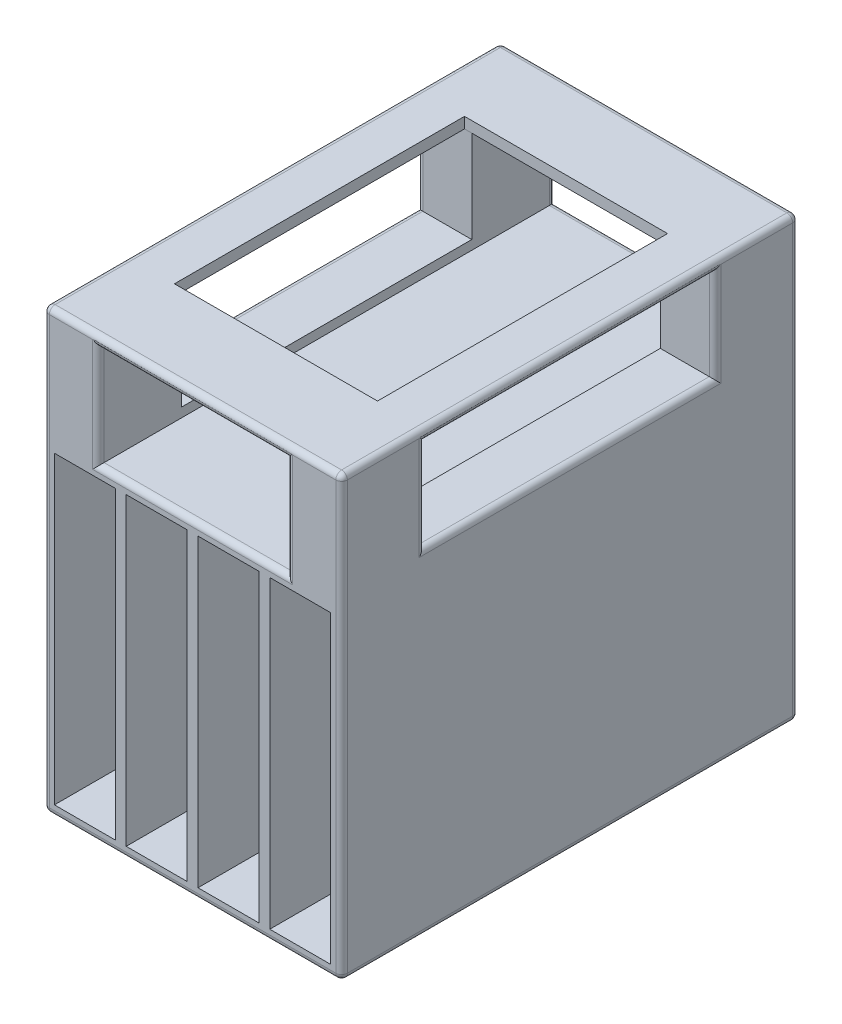
from build123d import *

# Parameters (mm, degrees)
SKETCH7_W           = 102.75
SKETCH7_H           = 151.25
BOSS_EXTRUDE4_DEPTH = 157.5
SKETCH9_W           = 65
SKETCH9_H           = 35
SKETCH9_W_2         = 21
SKETCH9_H_2         = 105
CUT_EXTRUDE5_DEPTH  = 157.5
SKETCH10_W          = 100
SKETCH10_H          = 31.776495021
CUT_EXTRUDE6_DEPTH  = 157.5
FILLET3_R           = 2
FILLET4_R           = 2
FILLET6_R           = 2
FILLET7_R           = 2
FILLET8_R           = 2
FILLET9_R           = 2
SKETCH13_W          = 70
SKETCH13_H          = 100
CUT_EXTRUDE7_DEPTH  = 3.75


with BuildPart() as part:
    # Sketch7 → Boss-Extrude4 (new body)
    with BuildSketch(Plane.XY):
        with Locations((-8.261523783, -58.812543528)):
            Rectangle(SKETCH7_W, SKETCH7_H)
    extrude(amount=BOSS_EXTRUDE4_DEPTH)

    # Sketch9 → Cut-Extrude5 (cut)
    with BuildSketch(Plane.XY.offset(157.5)):
        with Locations((-8.261523783, -4.437543528)):
            Rectangle(SKETCH9_W, SKETCH9_H)
        with Locations((-45.386523783, -78.187543528)):
            Rectangle(SKETCH9_W_2, SKETCH9_H_2)
        with Locations((-20.636523783, -78.187543528)):
            Rectangle(SKETCH9_W_2, SKETCH9_H_2)
        with Locations((4.113476217, -78.187543528)):
            Rectangle(SKETCH9_W_2, SKETCH9_H_2)
        with Locations((28.863476217, -78.187543528)):
            Rectangle(SKETCH9_W_2, SKETCH9_H_2)
    extrude(amount=-CUT_EXTRUDE5_DEPTH, mode=Mode.SUBTRACT)

    # Sketch10 → Cut-Extrude6 (cut)
    with BuildSketch(Plane.ZY.offset(59.636523783)):
        with Locations((78.75, -2.825791039)):
            Rectangle(SKETCH10_W, SKETCH10_H)
    extrude(amount=-CUT_EXTRUDE6_DEPTH, mode=Mode.SUBTRACT)

    # Fillet3
    fillet3_edges = [part.edges().sort_by_distance(p)[0] for p in [
        (43.113476217, 16.812456472, 78.75),
    ]]
    fillet(fillet3_edges, radius=FILLET3_R)

    # Fillet4
    fillet4_edges = [part.edges().sort_by_distance(p)[0] for p in [
        (-9.261523783, 16.812456472, 0),
        (-9.261523783, 16.812456472, 157.5),
        (42.52768978, 16.226670034, 0),
        (42.52768978, 16.226670034, 157.5),
        (43.113476217, -59.812543528, 157.5),
        (43.113476217, -59.812543528, 0),
        (-59.636523783, 16.812456472, 78.75),
    ]]
    fillet(fillet4_edges, radius=FILLET4_R)

    # Fillet6
    # the kernel refuses this fillet: 2 mm, written as the material it takes off along each edge
    with BuildSketch(Plane(origin=(-57.636523783, 14.812456472, 155.5), x_dir=(-1, 0, 0), z_dir=(0, 0, 1))) as fillet6_piece_1_section:
        Polygon((0, 0), (FILLET6_R, 0), (FILLET6_R, -FILLET6_R), (0, -FILLET6_R), align=None)
    fillet6_piece_1 = extrude(amount=FILLET6_R, mode=Mode.PRIVATE)
    fillet6_piece_1 = fillet6_piece_1 - Plane(origin=(-57.636523783, 14.812456472, 155.5), x_dir=(0.7071067811865475, -0.7071067811865475, 0), z_dir=(0, 0, 1)) * Sphere(FILLET6_R, mode=Mode.PRIVATE)
    add(fillet6_piece_1, mode=Mode.SUBTRACT)
    with BuildSketch(Plane(origin=(-57.636523783, 14.812456472, 2), x_dir=(-1, 0, 0), z_dir=(0, 0, -1))) as fillet6_piece_2_section:
        Polygon((0, 0), (FILLET6_R, 0), (FILLET6_R, FILLET6_R), (0, FILLET6_R), align=None)
    fillet6_piece_2 = extrude(amount=FILLET6_R, mode=Mode.PRIVATE)
    fillet6_piece_2 = fillet6_piece_2 - Plane(origin=(-57.636523783, 14.812456472, 2), x_dir=(0.7071067811865475, -0.7071067811865475, 0), z_dir=(0, 0, -1)) * Sphere(FILLET6_R, mode=Mode.PRIVATE)
    add(fillet6_piece_2, mode=Mode.SUBTRACT)
    with BuildSketch(Plane(origin=(-59.636523783, -139.437543528, 0), x_dir=(1, 0, 0), z_dir=(0, 1, 0))) as fillet6_piece_3:
        with BuildLine():
            CenterArc((FILLET6_R, -FILLET6_R), FILLET6_R, 90, 90)
            Line((0, -FILLET6_R), (0, 0))
            Line((0, 0), (FILLET6_R, 0))
        make_face()
    extrude(amount=154.25, mode=Mode.SUBTRACT)
    with BuildSketch(Plane(origin=(-59.636523783, -139.437543528, 157.5), x_dir=(1, 0, 0), z_dir=(0, 1, 0))) as fillet6_piece_4:
        with BuildLine():
            CenterArc((FILLET6_R, FILLET6_R), FILLET6_R, 180, 90)
            Line((0, FILLET6_R), (0, 0))
            Line((0, 0), (FILLET6_R, 0))
        make_face()
    extrude(amount=154.25, mode=Mode.SUBTRACT)
    with BuildSketch(Plane(origin=(-59.636523783, -134.437543528, -5), x_dir=(1, 0, 0), z_dir=(0, 0, 1))) as fillet6_piece_5:
        with BuildLine():
            CenterArc((FILLET6_R, FILLET6_R), FILLET6_R, 180, 90)
            Line((0, FILLET6_R), (0, 0))
            Line((0, 0), (FILLET6_R, 0))
        make_face()
    extrude(amount=167.5, mode=Mode.SUBTRACT)

    # Fillet7
    # the kernel refuses this fillet: 2 mm, written as the material it takes off along each edge
    with BuildSketch(Plane(origin=(-57.636523783, -132.437543528, 155.5), x_dir=(0, 0, 1), z_dir=(0, -1, 0))) as fillet7_piece_1_section:
        Polygon((0, 0), (FILLET7_R, 0), (FILLET7_R, FILLET7_R), (0, FILLET7_R), align=None)
    fillet7_piece_1 = extrude(amount=FILLET7_R, mode=Mode.PRIVATE)
    fillet7_piece_1 = fillet7_piece_1 - Plane(origin=(-57.636523783, -132.437543528, 155.5), x_dir=(0.7071067811865475, 0, -0.7071067811865475), z_dir=(0, -1, 0)) * Sphere(FILLET7_R, mode=Mode.PRIVATE)
    add(fillet7_piece_1, mode=Mode.SUBTRACT)
    with BuildSketch(Plane(origin=(-57.636523783, -132.437543528, 2), x_dir=(0, 0, -1), z_dir=(0, -1, 0))) as fillet7_piece_2_section:
        Polygon((0, 0), (FILLET7_R, 0), (FILLET7_R, -FILLET7_R), (0, -FILLET7_R), align=None)
    fillet7_piece_2 = extrude(amount=FILLET7_R, mode=Mode.PRIVATE)
    fillet7_piece_2 = fillet7_piece_2 - Plane(origin=(-57.636523783, -132.437543528, 2), x_dir=(0.7071067811865475, 0, 0.7071067811865475), z_dir=(0, -1, 0)) * Sphere(FILLET7_R, mode=Mode.PRIVATE)
    add(fillet7_piece_2, mode=Mode.SUBTRACT)
    with BuildSketch(Plane(origin=(43.113476217, -134.437543528, 2), x_dir=(0, 1, 0), z_dir=(0, 0, 1))) as fillet7_piece_3:
        with BuildLine():
            CenterArc((FILLET7_R, FILLET7_R), FILLET7_R, 180, 90)
            Line((0, FILLET7_R), (0, 0))
            Line((0, 0), (FILLET7_R, 0))
        make_face()
    extrude(amount=153.5, mode=Mode.SUBTRACT)
    with BuildSketch(Plane(origin=(41.113476217, -134.437543528, 155.5), x_dir=(0, 0, 1), z_dir=(-1, 0, 0))) as fillet7_piece_4:
        with BuildLine():
            CenterArc((2 - FILLET7_R, FILLET7_R), FILLET7_R, 270, 90)
            Line((2 - FILLET7_R, 0), (2, 0))
            Line((2, 0), (2, FILLET7_R))
        make_face()
    revolve(axis=Axis((41.113476217, -134.437543528, 155.5), (0, 1, 0)), revolution_arc=90, mode=Mode.SUBTRACT)
    with BuildSketch(Plane(origin=(41.113476217, -134.437543528, 2), x_dir=(0, 0, -1), z_dir=(-1, 0, 0))) as fillet7_piece_5:
        with BuildLine():
            CenterArc((2 - FILLET7_R, -FILLET7_R), FILLET7_R, 0, 90)
            Line((2 - FILLET7_R, 0), (2, 0))
            Line((2, 0), (2, -FILLET7_R))
        make_face()
    revolve(axis=Axis((41.113476217, -134.437543528, 2), (0, -1, 0)), revolution_arc=90, mode=Mode.SUBTRACT)
    with BuildSketch(Plane(origin=(41.113476217, -134.437543528, 0), x_dir=(0, 0, 1), z_dir=(-1, 0, 0))) as fillet7_piece_6:
        with BuildLine():
            CenterArc((FILLET7_R, FILLET7_R), FILLET7_R, 180, 90)
            Line((0, FILLET7_R), (0, 0))
            Line((0, 0), (FILLET7_R, 0))
        make_face()
    extrude(amount=98.75, mode=Mode.SUBTRACT)
    with BuildSketch(Plane(origin=(41.113476217, -134.437543528, 157.5), x_dir=(0, 0, -1), z_dir=(-1, 0, 0))) as fillet7_piece_7:
        with BuildLine():
            CenterArc((FILLET7_R, -FILLET7_R), FILLET7_R, 90, 90)
            Line((0, -FILLET7_R), (0, 0))
            Line((0, 0), (FILLET7_R, 0))
        make_face()
    extrude(amount=98.75, mode=Mode.SUBTRACT)

    # Fillet8
    # the kernel refuses this fillet: 2 mm, written as the material it takes off along each edge
    with BuildSketch(Plane(origin=(-40.761523783, -21.937543528, 0), x_dir=(-1, 0, 0), z_dir=(0, 1, 0)), Plane(origin=(24.238476217, 13.062456472, 0), x_dir=(1, 0, 0), z_dir=(0, -1, 0))) as fillet8_piece_1:
        with BuildLine():
            CenterArc((FILLET8_R, FILLET8_R), FILLET8_R, 180, 90)
            Line((0, FILLET8_R), (0, 0))
            Line((0, 0), (FILLET8_R, 0))
        make_face()
    extrude(amount=35, mode=Mode.SUBTRACT)
    with BuildSketch(Plane(origin=(-40.761523783, 13.062456472, 0), x_dir=(0, 0, 1), z_dir=(1, 0, 0))) as fillet8_piece_2:
        with BuildLine():
            CenterArc((FILLET8_R, -FILLET8_R), FILLET8_R, 90, 90)
            Line((0, -FILLET8_R), (0, 0))
            Line((0, 0), (FILLET8_R, 0))
        make_face()
    extrude(amount=65, mode=Mode.SUBTRACT)
    with BuildSketch(Plane(origin=(24.238476217, -21.937543528, 0), x_dir=(0, -1, 0), z_dir=(-1, 0, 0))) as fillet8_piece_3:
        with BuildLine():
            CenterArc((FILLET8_R, FILLET8_R), FILLET8_R, 180, 90)
            Line((0, FILLET8_R), (0, 0))
            Line((0, 0), (FILLET8_R, 0))
        make_face()
    extrude(amount=65, mode=Mode.SUBTRACT)
    with BuildSketch(Plane(origin=(-40.761523783, -26.937543528, 0), x_dir=(-1, 0, 0), z_dir=(0, 1, 0))) as fillet8_piece_4a_section:
        with BuildLine():
            CenterArc((FILLET8_R, FILLET8_R), FILLET8_R, 180, 90)
            Line((0, FILLET8_R), (0, 0))
            Line((0, 0), (FILLET8_R, 0))
        make_face()
    fillet8_piece_4a = extrude(amount=40, mode=Mode.PRIVATE)
    fillet8_piece_4a = split(fillet8_piece_4a, bisect_by=Plane(origin=(-40.761523783, -21.937543528, 0), z_dir=(0, -1, 0)), keep=Keep.TOP, mode=Mode.PRIVATE)
    with BuildSketch(Plane(origin=(24.238476217, -21.937543528, 0), x_dir=(0, -1, 0), z_dir=(-1, 0, 0))) as fillet8_piece_4b_section:
        with BuildLine():
            CenterArc((FILLET8_R, FILLET8_R), FILLET8_R, 180, 90)
            Line((0, FILLET8_R), (0, 0))
            Line((0, 0), (FILLET8_R, 0))
        make_face()
    fillet8_piece_4b = extrude(amount=70, mode=Mode.PRIVATE)
    fillet8_piece_4b = split(fillet8_piece_4b, bisect_by=Plane(origin=(-40.761523783, -21.937543528, 0), z_dir=(-1, 0, 0)), keep=Keep.TOP, mode=Mode.PRIVATE)
    fillet8_piece_4 = fillet8_piece_4a & fillet8_piece_4b
    add(fillet8_piece_4, mode=Mode.SUBTRACT)
    with BuildSketch(Plane(origin=(-45.761523783, 13.062456472, 0), x_dir=(0, 0, 1), z_dir=(1, 0, 0))) as fillet8_piece_5a_section:
        with BuildLine():
            CenterArc((FILLET8_R, -FILLET8_R), FILLET8_R, 90, 90)
            Line((0, -FILLET8_R), (0, 0))
            Line((0, 0), (FILLET8_R, 0))
        make_face()
    fillet8_piece_5a = extrude(amount=70, mode=Mode.PRIVATE)
    fillet8_piece_5a = split(fillet8_piece_5a, bisect_by=Plane(origin=(-40.761523783, 13.062456472, 0), z_dir=(-1, 0, 0)), keep=Keep.TOP, mode=Mode.PRIVATE)
    with BuildSketch(Plane(origin=(-40.761523783, -21.937543528, 0), x_dir=(-1, 0, 0), z_dir=(0, 1, 0))) as fillet8_piece_5b_section:
        with BuildLine():
            CenterArc((FILLET8_R, FILLET8_R), FILLET8_R, 180, 90)
            Line((0, FILLET8_R), (0, 0))
            Line((0, 0), (FILLET8_R, 0))
        make_face()
    fillet8_piece_5b = extrude(amount=40, mode=Mode.PRIVATE)
    fillet8_piece_5b = split(fillet8_piece_5b, bisect_by=Plane(origin=(-40.761523783, 13.062456472, 0), z_dir=(0, 1, 0)), keep=Keep.TOP, mode=Mode.PRIVATE)
    fillet8_piece_5 = fillet8_piece_5a & fillet8_piece_5b
    add(fillet8_piece_5, mode=Mode.SUBTRACT)
    with BuildSketch(Plane(origin=(-40.761523783, 13.062456472, 0), x_dir=(0, 0, 1), z_dir=(1, 0, 0))) as fillet8_piece_6a_section:
        with BuildLine():
            CenterArc((FILLET8_R, -FILLET8_R), FILLET8_R, 90, 90)
            Line((0, -FILLET8_R), (0, 0))
            Line((0, 0), (FILLET8_R, 0))
        make_face()
    fillet8_piece_6a = extrude(amount=70, mode=Mode.PRIVATE)
    fillet8_piece_6a = split(fillet8_piece_6a, bisect_by=Plane(origin=(24.238476217, 13.062456472, 0), z_dir=(1, 0, 0)), keep=Keep.TOP, mode=Mode.PRIVATE)
    with BuildSketch(Plane(origin=(24.238476217, 18.062456472, 0), x_dir=(1, 0, 0), z_dir=(0, -1, 0))) as fillet8_piece_6b_section:
        with BuildLine():
            CenterArc((FILLET8_R, FILLET8_R), FILLET8_R, 180, 90)
            Line((0, FILLET8_R), (0, 0))
            Line((0, 0), (FILLET8_R, 0))
        make_face()
    fillet8_piece_6b = extrude(amount=40, mode=Mode.PRIVATE)
    fillet8_piece_6b = split(fillet8_piece_6b, bisect_by=Plane(origin=(24.238476217, 13.062456472, 0), z_dir=(0, 1, 0)), keep=Keep.TOP, mode=Mode.PRIVATE)
    fillet8_piece_6 = fillet8_piece_6a & fillet8_piece_6b
    add(fillet8_piece_6, mode=Mode.SUBTRACT)
    with BuildSketch(Plane(origin=(24.238476217, 13.062456472, 0), x_dir=(1, 0, 0), z_dir=(0, -1, 0))) as fillet8_piece_7a_section:
        with BuildLine():
            CenterArc((FILLET8_R, FILLET8_R), FILLET8_R, 180, 90)
            Line((0, FILLET8_R), (0, 0))
            Line((0, 0), (FILLET8_R, 0))
        make_face()
    fillet8_piece_7a = extrude(amount=40, mode=Mode.PRIVATE)
    fillet8_piece_7a = split(fillet8_piece_7a, bisect_by=Plane(origin=(24.238476217, -21.937543528, 0), z_dir=(0, -1, 0)), keep=Keep.TOP, mode=Mode.PRIVATE)
    with BuildSketch(Plane(origin=(29.238476217, -21.937543528, 0), x_dir=(0, -1, 0), z_dir=(-1, 0, 0))) as fillet8_piece_7b_section:
        with BuildLine():
            CenterArc((FILLET8_R, FILLET8_R), FILLET8_R, 180, 90)
            Line((0, FILLET8_R), (0, 0))
            Line((0, 0), (FILLET8_R, 0))
        make_face()
    fillet8_piece_7b = extrude(amount=70, mode=Mode.PRIVATE)
    fillet8_piece_7b = split(fillet8_piece_7b, bisect_by=Plane(origin=(24.238476217, -21.937543528, 0), z_dir=(1, 0, 0)), keep=Keep.TOP, mode=Mode.PRIVATE)
    fillet8_piece_7 = fillet8_piece_7a & fillet8_piece_7b
    add(fillet8_piece_7, mode=Mode.SUBTRACT)

    # Fillet9
    # the kernel refuses this fillet: 2 mm, written as the material it takes off along each edge
    with BuildSketch(Plane(origin=(-59.636523783, -18.714038549, 28.75), x_dir=(1, 0, 0), z_dir=(0, 1, 0))) as fillet9_piece_1:
        with BuildLine():
            CenterArc((FILLET9_R, FILLET9_R), FILLET9_R, 180, 90)
            Line((0, FILLET9_R), (0, 0))
            Line((0, 0), (FILLET9_R, 0))
        make_face()
    extrude(amount=31.776495021, mode=Mode.SUBTRACT)
    with BuildSketch(Plane(origin=(-59.636523783, -18.714038549, 128.75), x_dir=(0, -1, 0), z_dir=(0, 0, -1)), Plane(origin=(-59.636523783, 13.062456472, 28.75), x_dir=(0, 1, 0), z_dir=(0, 0, 1)), Plane(origin=(43.113476217, 13.062456472, 128.75), x_dir=(0, 1, 0), z_dir=(0, 0, -1)), Plane(origin=(43.113476217, -18.714038549, 28.75), x_dir=(0, -1, 0), z_dir=(0, 0, 1))) as fillet9_piece_2:
        with BuildLine():
            CenterArc((FILLET9_R, -FILLET9_R), FILLET9_R, 90, 90)
            Line((0, -FILLET9_R), (0, 0))
            Line((0, 0), (FILLET9_R, 0))
        make_face()
    extrude(amount=100, mode=Mode.SUBTRACT)
    with BuildSketch(Plane(origin=(-59.636523783, 13.062456472, 128.75), x_dir=(0, 0, 1), z_dir=(0, -1, 0)), Plane(origin=(43.113476217, 13.062456472, 28.75), x_dir=(0, 0, -1), z_dir=(0, -1, 0)), Plane(origin=(43.113476217, -18.714038549, 128.75), x_dir=(0, 0, 1), z_dir=(0, 1, 0))) as fillet9_piece_3:
        with BuildLine():
            CenterArc((FILLET9_R, -FILLET9_R), FILLET9_R, 90, 90)
            Line((0, -FILLET9_R), (0, 0))
            Line((0, 0), (FILLET9_R, 0))
        make_face()
    extrude(amount=31.776495021, mode=Mode.SUBTRACT)
    with BuildSketch(Plane(origin=(-40.761523783, -21.937543528, 157.5), x_dir=(0, 0, -1), z_dir=(0, 1, 0)), Plane(origin=(24.238476217, 13.062456472, 157.5), x_dir=(0, 0, -1), z_dir=(0, -1, 0))) as fillet9_piece_4:
        with BuildLine():
            CenterArc((FILLET9_R, FILLET9_R), FILLET9_R, 180, 90)
            Line((0, FILLET9_R), (0, 0))
            Line((0, 0), (FILLET9_R, 0))
        make_face()
    extrude(amount=35, mode=Mode.SUBTRACT)
    with BuildSketch(Plane(origin=(24.238476217, -21.937543528, 157.5), x_dir=(0, 0, -1), z_dir=(-1, 0, 0))) as fillet9_piece_5:
        with BuildLine():
            CenterArc((FILLET9_R, FILLET9_R), FILLET9_R, 180, 90)
            Line((0, FILLET9_R), (0, 0))
            Line((0, 0), (FILLET9_R, 0))
        make_face()
    extrude(amount=65, mode=Mode.SUBTRACT)
    with BuildSketch(Plane(origin=(-40.761523783, 13.062456472, 157.5), x_dir=(0, 1, 0), z_dir=(1, 0, 0))) as fillet9_piece_6:
        with BuildLine():
            CenterArc((FILLET9_R, -FILLET9_R), FILLET9_R, 90, 90)
            Line((0, -FILLET9_R), (0, 0))
            Line((0, 0), (FILLET9_R, 0))
        make_face()
    extrude(amount=65, mode=Mode.SUBTRACT)
    with BuildSketch(Plane(origin=(-59.636523783, -23.714038549, 28.75), x_dir=(1, 0, 0), z_dir=(0, 1, 0))) as fillet9_piece_7a_section:
        with BuildLine():
            CenterArc((FILLET9_R, FILLET9_R), FILLET9_R, 180, 90)
            Line((0, FILLET9_R), (0, 0))
            Line((0, 0), (FILLET9_R, 0))
        make_face()
    fillet9_piece_7a = extrude(amount=36.776495021, mode=Mode.PRIVATE)
    fillet9_piece_7a = split(fillet9_piece_7a, bisect_by=Plane(origin=(-59.636523783, -18.714038549, 28.75), z_dir=(0, -1, 0)), keep=Keep.TOP, mode=Mode.PRIVATE)
    with BuildSketch(Plane(origin=(-59.636523783, -18.714038549, 128.75), x_dir=(0, -1, 0), z_dir=(0, 0, -1))) as fillet9_piece_7b_section:
        with BuildLine():
            CenterArc((FILLET9_R, -FILLET9_R), FILLET9_R, 90, 90)
            Line((0, -FILLET9_R), (0, 0))
            Line((0, 0), (FILLET9_R, 0))
        make_face()
    fillet9_piece_7b = extrude(amount=105, mode=Mode.PRIVATE)
    fillet9_piece_7b = split(fillet9_piece_7b, bisect_by=Plane(origin=(-59.636523783, -18.714038549, 28.75), z_dir=(0, 0, -1)), keep=Keep.TOP, mode=Mode.PRIVATE)
    fillet9_piece_7 = fillet9_piece_7a & fillet9_piece_7b
    add(fillet9_piece_7, mode=Mode.SUBTRACT)
    with BuildSketch(Plane(origin=(-59.636523783, -18.714038549, 28.75), x_dir=(1, 0, 0), z_dir=(0, 1, 0))) as fillet9_piece_8a_section:
        with BuildLine():
            CenterArc((FILLET9_R, FILLET9_R), FILLET9_R, 180, 90)
            Line((0, FILLET9_R), (0, 0))
            Line((0, 0), (FILLET9_R, 0))
        make_face()
    fillet9_piece_8a = extrude(amount=36.776495021, mode=Mode.PRIVATE)
    fillet9_piece_8a = split(fillet9_piece_8a, bisect_by=Plane(origin=(-59.636523783, 13.062456472, 28.75), z_dir=(0, 1, 0)), keep=Keep.TOP, mode=Mode.PRIVATE)
    with BuildSketch(Plane(origin=(-59.636523783, 13.062456472, 23.75), x_dir=(0, 1, 0), z_dir=(0, 0, 1))) as fillet9_piece_8b_section:
        with BuildLine():
            CenterArc((FILLET9_R, -FILLET9_R), FILLET9_R, 90, 90)
            Line((0, -FILLET9_R), (0, 0))
            Line((0, 0), (FILLET9_R, 0))
        make_face()
    fillet9_piece_8b = extrude(amount=105, mode=Mode.PRIVATE)
    fillet9_piece_8b = split(fillet9_piece_8b, bisect_by=Plane(origin=(-59.636523783, 13.062456472, 28.75), z_dir=(0, 0, -1)), keep=Keep.TOP, mode=Mode.PRIVATE)
    fillet9_piece_8 = fillet9_piece_8a & fillet9_piece_8b
    add(fillet9_piece_8, mode=Mode.SUBTRACT)
    with BuildSketch(Plane(origin=(-59.636523783, -18.714038549, 133.75), x_dir=(0, -1, 0), z_dir=(0, 0, -1))) as fillet9_piece_9a_section:
        with BuildLine():
            CenterArc((FILLET9_R, -FILLET9_R), FILLET9_R, 90, 90)
            Line((0, -FILLET9_R), (0, 0))
            Line((0, 0), (FILLET9_R, 0))
        make_face()
    fillet9_piece_9a = extrude(amount=105, mode=Mode.PRIVATE)
    fillet9_piece_9a = split(fillet9_piece_9a, bisect_by=Plane(origin=(-59.636523783, -18.714038549, 128.75), z_dir=(0, 0, 1)), keep=Keep.TOP, mode=Mode.PRIVATE)
    with BuildSketch(Plane(origin=(-59.636523783, 13.062456472, 128.75), x_dir=(0, 0, 1), z_dir=(0, -1, 0))) as fillet9_piece_9b_section:
        with BuildLine():
            CenterArc((FILLET9_R, -FILLET9_R), FILLET9_R, 90, 90)
            Line((0, -FILLET9_R), (0, 0))
            Line((0, 0), (FILLET9_R, 0))
        make_face()
    fillet9_piece_9b = extrude(amount=36.776495021, mode=Mode.PRIVATE)
    fillet9_piece_9b = split(fillet9_piece_9b, bisect_by=Plane(origin=(-59.636523783, -18.714038549, 128.75), z_dir=(0, -1, 0)), keep=Keep.TOP, mode=Mode.PRIVATE)
    fillet9_piece_9 = fillet9_piece_9a & fillet9_piece_9b
    add(fillet9_piece_9, mode=Mode.SUBTRACT)
    with BuildSketch(Plane(origin=(-59.636523783, 13.062456472, 28.75), x_dir=(0, 1, 0), z_dir=(0, 0, 1))) as fillet9_piece_10a_section:
        with BuildLine():
            CenterArc((FILLET9_R, -FILLET9_R), FILLET9_R, 90, 90)
            Line((0, -FILLET9_R), (0, 0))
            Line((0, 0), (FILLET9_R, 0))
        make_face()
    fillet9_piece_10a = extrude(amount=105, mode=Mode.PRIVATE)
    fillet9_piece_10a = split(fillet9_piece_10a, bisect_by=Plane(origin=(-59.636523783, 13.062456472, 128.75), z_dir=(0, 0, 1)), keep=Keep.TOP, mode=Mode.PRIVATE)
    with BuildSketch(Plane(origin=(-59.636523783, 18.062456472, 128.75), x_dir=(0, 0, 1), z_dir=(0, -1, 0))) as fillet9_piece_10b_section:
        with BuildLine():
            CenterArc((FILLET9_R, -FILLET9_R), FILLET9_R, 90, 90)
            Line((0, -FILLET9_R), (0, 0))
            Line((0, 0), (FILLET9_R, 0))
        make_face()
    fillet9_piece_10b = extrude(amount=36.776495021, mode=Mode.PRIVATE)
    fillet9_piece_10b = split(fillet9_piece_10b, bisect_by=Plane(origin=(-59.636523783, 13.062456472, 128.75), z_dir=(0, 1, 0)), keep=Keep.TOP, mode=Mode.PRIVATE)
    fillet9_piece_10 = fillet9_piece_10a & fillet9_piece_10b
    add(fillet9_piece_10, mode=Mode.SUBTRACT)
    with BuildSketch(Plane(origin=(-40.761523783, -26.937543528, 157.5), x_dir=(0, 0, -1), z_dir=(0, 1, 0))) as fillet9_piece_11a_section:
        with BuildLine():
            CenterArc((FILLET9_R, FILLET9_R), FILLET9_R, 180, 90)
            Line((0, FILLET9_R), (0, 0))
            Line((0, 0), (FILLET9_R, 0))
        make_face()
    fillet9_piece_11a = extrude(amount=40, mode=Mode.PRIVATE)
    fillet9_piece_11a = split(fillet9_piece_11a, bisect_by=Plane(origin=(-40.761523783, -21.937543528, 157.5), z_dir=(0, -1, 0)), keep=Keep.TOP, mode=Mode.PRIVATE)
    with BuildSketch(Plane(origin=(24.238476217, -21.937543528, 157.5), x_dir=(0, 0, -1), z_dir=(-1, 0, 0))) as fillet9_piece_11b_section:
        with BuildLine():
            CenterArc((FILLET9_R, FILLET9_R), FILLET9_R, 180, 90)
            Line((0, FILLET9_R), (0, 0))
            Line((0, 0), (FILLET9_R, 0))
        make_face()
    fillet9_piece_11b = extrude(amount=70, mode=Mode.PRIVATE)
    fillet9_piece_11b = split(fillet9_piece_11b, bisect_by=Plane(origin=(-40.761523783, -21.937543528, 157.5), z_dir=(-1, 0, 0)), keep=Keep.TOP, mode=Mode.PRIVATE)
    fillet9_piece_11 = fillet9_piece_11a & fillet9_piece_11b
    add(fillet9_piece_11, mode=Mode.SUBTRACT)
    with BuildSketch(Plane(origin=(-40.761523783, -21.937543528, 157.5), x_dir=(0, 0, -1), z_dir=(0, 1, 0))) as fillet9_piece_12a_section:
        with BuildLine():
            CenterArc((FILLET9_R, FILLET9_R), FILLET9_R, 180, 90)
            Line((0, FILLET9_R), (0, 0))
            Line((0, 0), (FILLET9_R, 0))
        make_face()
    fillet9_piece_12a = extrude(amount=40, mode=Mode.PRIVATE)
    fillet9_piece_12a = split(fillet9_piece_12a, bisect_by=Plane(origin=(-40.761523783, 13.062456472, 157.5), z_dir=(0, 1, 0)), keep=Keep.TOP, mode=Mode.PRIVATE)
    with BuildSketch(Plane(origin=(-45.761523783, 13.062456472, 157.5), x_dir=(0, 1, 0), z_dir=(1, 0, 0))) as fillet9_piece_12b_section:
        with BuildLine():
            CenterArc((FILLET9_R, -FILLET9_R), FILLET9_R, 90, 90)
            Line((0, -FILLET9_R), (0, 0))
            Line((0, 0), (FILLET9_R, 0))
        make_face()
    fillet9_piece_12b = extrude(amount=70, mode=Mode.PRIVATE)
    fillet9_piece_12b = split(fillet9_piece_12b, bisect_by=Plane(origin=(-40.761523783, 13.062456472, 157.5), z_dir=(-1, 0, 0)), keep=Keep.TOP, mode=Mode.PRIVATE)
    fillet9_piece_12 = fillet9_piece_12a & fillet9_piece_12b
    add(fillet9_piece_12, mode=Mode.SUBTRACT)
    with BuildSketch(Plane(origin=(24.238476217, 13.062456472, 157.5), x_dir=(0, 0, -1), z_dir=(0, -1, 0))) as fillet9_piece_13a_section:
        with BuildLine():
            CenterArc((FILLET9_R, FILLET9_R), FILLET9_R, 180, 90)
            Line((0, FILLET9_R), (0, 0))
            Line((0, 0), (FILLET9_R, 0))
        make_face()
    fillet9_piece_13a = extrude(amount=40, mode=Mode.PRIVATE)
    fillet9_piece_13a = split(fillet9_piece_13a, bisect_by=Plane(origin=(24.238476217, -21.937543528, 157.5), z_dir=(0, -1, 0)), keep=Keep.TOP, mode=Mode.PRIVATE)
    with BuildSketch(Plane(origin=(29.238476217, -21.937543528, 157.5), x_dir=(0, 0, -1), z_dir=(-1, 0, 0))) as fillet9_piece_13b_section:
        with BuildLine():
            CenterArc((FILLET9_R, FILLET9_R), FILLET9_R, 180, 90)
            Line((0, FILLET9_R), (0, 0))
            Line((0, 0), (FILLET9_R, 0))
        make_face()
    fillet9_piece_13b = extrude(amount=70, mode=Mode.PRIVATE)
    fillet9_piece_13b = split(fillet9_piece_13b, bisect_by=Plane(origin=(24.238476217, -21.937543528, 157.5), z_dir=(1, 0, 0)), keep=Keep.TOP, mode=Mode.PRIVATE)
    fillet9_piece_13 = fillet9_piece_13a & fillet9_piece_13b
    add(fillet9_piece_13, mode=Mode.SUBTRACT)
    with BuildSketch(Plane(origin=(24.238476217, 18.062456472, 157.5), x_dir=(0, 0, -1), z_dir=(0, -1, 0))) as fillet9_piece_14a_section:
        with BuildLine():
            CenterArc((FILLET9_R, FILLET9_R), FILLET9_R, 180, 90)
            Line((0, FILLET9_R), (0, 0))
            Line((0, 0), (FILLET9_R, 0))
        make_face()
    fillet9_piece_14a = extrude(amount=40, mode=Mode.PRIVATE)
    fillet9_piece_14a = split(fillet9_piece_14a, bisect_by=Plane(origin=(24.238476217, 13.062456472, 157.5), z_dir=(0, 1, 0)), keep=Keep.TOP, mode=Mode.PRIVATE)
    with BuildSketch(Plane(origin=(-40.761523783, 13.062456472, 157.5), x_dir=(0, 1, 0), z_dir=(1, 0, 0))) as fillet9_piece_14b_section:
        with BuildLine():
            CenterArc((FILLET9_R, -FILLET9_R), FILLET9_R, 90, 90)
            Line((0, -FILLET9_R), (0, 0))
            Line((0, 0), (FILLET9_R, 0))
        make_face()
    fillet9_piece_14b = extrude(amount=70, mode=Mode.PRIVATE)
    fillet9_piece_14b = split(fillet9_piece_14b, bisect_by=Plane(origin=(24.238476217, 13.062456472, 157.5), z_dir=(1, 0, 0)), keep=Keep.TOP, mode=Mode.PRIVATE)
    fillet9_piece_14 = fillet9_piece_14a & fillet9_piece_14b
    add(fillet9_piece_14, mode=Mode.SUBTRACT)
    with BuildSketch(Plane(origin=(43.113476217, 13.062456472, 128.75), x_dir=(0, 1, 0), z_dir=(0, 0, -1))) as fillet9_piece_15a_section:
        with BuildLine():
            CenterArc((FILLET9_R, -FILLET9_R), FILLET9_R, 90, 90)
            Line((0, -FILLET9_R), (0, 0))
            Line((0, 0), (FILLET9_R, 0))
        make_face()
    fillet9_piece_15a = extrude(amount=105, mode=Mode.PRIVATE)
    fillet9_piece_15a = split(fillet9_piece_15a, bisect_by=Plane(origin=(43.113476217, 13.062456472, 28.75), z_dir=(0, 0, -1)), keep=Keep.TOP, mode=Mode.PRIVATE)
    with BuildSketch(Plane(origin=(43.113476217, 18.062456472, 28.75), x_dir=(0, 0, -1), z_dir=(0, -1, 0))) as fillet9_piece_15b_section:
        with BuildLine():
            CenterArc((FILLET9_R, -FILLET9_R), FILLET9_R, 90, 90)
            Line((0, -FILLET9_R), (0, 0))
            Line((0, 0), (FILLET9_R, 0))
        make_face()
    fillet9_piece_15b = extrude(amount=36.776495021, mode=Mode.PRIVATE)
    fillet9_piece_15b = split(fillet9_piece_15b, bisect_by=Plane(origin=(43.113476217, 13.062456472, 28.75), z_dir=(0, 1, 0)), keep=Keep.TOP, mode=Mode.PRIVATE)
    fillet9_piece_15 = fillet9_piece_15a & fillet9_piece_15b
    add(fillet9_piece_15, mode=Mode.SUBTRACT)
    with BuildSketch(Plane(origin=(43.113476217, -18.714038549, 23.75), x_dir=(0, -1, 0), z_dir=(0, 0, 1))) as fillet9_piece_16a_section:
        with BuildLine():
            CenterArc((FILLET9_R, -FILLET9_R), FILLET9_R, 90, 90)
            Line((0, -FILLET9_R), (0, 0))
            Line((0, 0), (FILLET9_R, 0))
        make_face()
    fillet9_piece_16a = extrude(amount=105, mode=Mode.PRIVATE)
    fillet9_piece_16a = split(fillet9_piece_16a, bisect_by=Plane(origin=(43.113476217, -18.714038549, 28.75), z_dir=(0, 0, -1)), keep=Keep.TOP, mode=Mode.PRIVATE)
    with BuildSketch(Plane(origin=(43.113476217, 13.062456472, 28.75), x_dir=(0, 0, -1), z_dir=(0, -1, 0))) as fillet9_piece_16b_section:
        with BuildLine():
            CenterArc((FILLET9_R, -FILLET9_R), FILLET9_R, 90, 90)
            Line((0, -FILLET9_R), (0, 0))
            Line((0, 0), (FILLET9_R, 0))
        make_face()
    fillet9_piece_16b = extrude(amount=36.776495021, mode=Mode.PRIVATE)
    fillet9_piece_16b = split(fillet9_piece_16b, bisect_by=Plane(origin=(43.113476217, -18.714038549, 28.75), z_dir=(0, -1, 0)), keep=Keep.TOP, mode=Mode.PRIVATE)
    fillet9_piece_16 = fillet9_piece_16a & fillet9_piece_16b
    add(fillet9_piece_16, mode=Mode.SUBTRACT)
    with BuildSketch(Plane(origin=(43.113476217, -18.714038549, 128.75), x_dir=(0, 0, 1), z_dir=(0, 1, 0))) as fillet9_piece_17a_section:
        with BuildLine():
            CenterArc((FILLET9_R, -FILLET9_R), FILLET9_R, 90, 90)
            Line((0, -FILLET9_R), (0, 0))
            Line((0, 0), (FILLET9_R, 0))
        make_face()
    fillet9_piece_17a = extrude(amount=36.776495021, mode=Mode.PRIVATE)
    fillet9_piece_17a = split(fillet9_piece_17a, bisect_by=Plane(origin=(43.113476217, 13.062456472, 128.75), z_dir=(0, 1, 0)), keep=Keep.TOP, mode=Mode.PRIVATE)
    with BuildSketch(Plane(origin=(43.113476217, 13.062456472, 133.75), x_dir=(0, 1, 0), z_dir=(0, 0, -1))) as fillet9_piece_17b_section:
        with BuildLine():
            CenterArc((FILLET9_R, -FILLET9_R), FILLET9_R, 90, 90)
            Line((0, -FILLET9_R), (0, 0))
            Line((0, 0), (FILLET9_R, 0))
        make_face()
    fillet9_piece_17b = extrude(amount=105, mode=Mode.PRIVATE)
    fillet9_piece_17b = split(fillet9_piece_17b, bisect_by=Plane(origin=(43.113476217, 13.062456472, 128.75), z_dir=(0, 0, 1)), keep=Keep.TOP, mode=Mode.PRIVATE)
    fillet9_piece_17 = fillet9_piece_17a & fillet9_piece_17b
    add(fillet9_piece_17, mode=Mode.SUBTRACT)
    with BuildSketch(Plane(origin=(43.113476217, -23.714038549, 128.75), x_dir=(0, 0, 1), z_dir=(0, 1, 0))) as fillet9_piece_18a_section:
        with BuildLine():
            CenterArc((FILLET9_R, -FILLET9_R), FILLET9_R, 90, 90)
            Line((0, -FILLET9_R), (0, 0))
            Line((0, 0), (FILLET9_R, 0))
        make_face()
    fillet9_piece_18a = extrude(amount=36.776495021, mode=Mode.PRIVATE)
    fillet9_piece_18a = split(fillet9_piece_18a, bisect_by=Plane(origin=(43.113476217, -18.714038549, 128.75), z_dir=(0, -1, 0)), keep=Keep.TOP, mode=Mode.PRIVATE)
    with BuildSketch(Plane(origin=(43.113476217, -18.714038549, 28.75), x_dir=(0, -1, 0), z_dir=(0, 0, 1))) as fillet9_piece_18b_section:
        with BuildLine():
            CenterArc((FILLET9_R, -FILLET9_R), FILLET9_R, 90, 90)
            Line((0, -FILLET9_R), (0, 0))
            Line((0, 0), (FILLET9_R, 0))
        make_face()
    fillet9_piece_18b = extrude(amount=105, mode=Mode.PRIVATE)
    fillet9_piece_18b = split(fillet9_piece_18b, bisect_by=Plane(origin=(43.113476217, -18.714038549, 128.75), z_dir=(0, 0, 1)), keep=Keep.TOP, mode=Mode.PRIVATE)
    fillet9_piece_18 = fillet9_piece_18a & fillet9_piece_18b
    add(fillet9_piece_18, mode=Mode.SUBTRACT)

    # Sketch13 → Cut-Extrude7 (cut)
    with BuildSketch(Plane(origin=(0, 16.812456472, 0), x_dir=(1, 0, 0), z_dir=(0, 1, 0))):
        with Locations((-8.265433855, -78.746089928)):
            Rectangle(SKETCH13_W, SKETCH13_H)
    extrude(amount=-CUT_EXTRUDE7_DEPTH, mode=Mode.SUBTRACT)


solid = part.part
